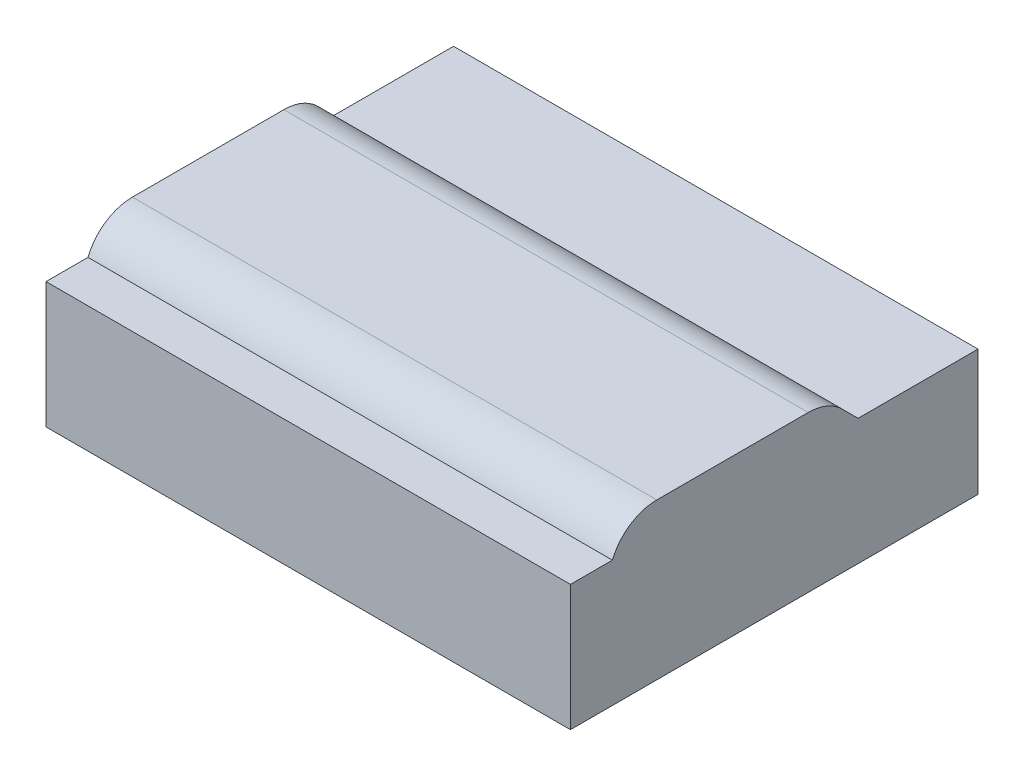
from build123d import *

# Parameters (mm, degrees)
SKETCH1_W           = 875
SKETCH1_H           = 680
BOSS_EXTRUDE1_DEPTH = 210
BOSS_EXTRUDE2_DEPTH = 875
FILLET1_R           = 80


with BuildPart() as part:
    # Sketch1 → Boss-Extrude1 (new body)
    with BuildSketch(Plane(origin=(0, 0, 0), x_dir=(1, 0, 0), z_dir=(0, 1, 0))):
        with Locations((0, 340)):
            Rectangle(SKETCH1_W, SKETCH1_H)
    extrude(amount=-BOSS_EXTRUDE1_DEPTH)

    # Sketch3 → Boss-Extrude2 (add)
    with BuildSketch(Plane.ZY.offset(437.5)):
        Polygon((-70, 0), (-70, 50), (-430, 50), (-480, 0), align=None)
    extrude(amount=-BOSS_EXTRUDE2_DEPTH)

    # Fillet1
    # the kernel refuses this fillet: 80 mm, written as the material it takes off along each edge
    with BuildSketch(Plane(origin=(-622.904962177, 50, -70), x_dir=(0, -1, 0), z_dir=(1, 0, 0))) as fillet1_piece_1:
        with BuildLine():
            CenterArc((80, 74.161984871), FILLET1_R, 180, 67.975687163)
            Line((0, 74.161984871), (-1.6, 74.161984871))
            Line((-1.6, 74.161984871), (-1.6, 0))
            Line((-1.6, 0), (0, -1.6))
            ThreePointArc((0, -1.6), (25, -1.6), (49.4, -1.483239697))
            Line((49.4, -1.483239697), (50, 0))
        make_face()
    extrude(amount=1245.809924355, mode=Mode.SUBTRACT)
    with BuildSketch(Plane(origin=(-520.342712475, 50, -430), x_dir=(0, -0.7071067811865477, -0.7071067811865474), z_dir=(1, 0, 0))) as fillet1_piece_2:
        with BuildLine():
            CenterArc((FILLET1_R * 0.414213562373, -FILLET1_R), FILLET1_R, 90, 45)
            Line((-FILLET1_R * 0.292893218813, -FILLET1_R * 0.292893218813), (-FILLET1_R * 0.307035354437, -FILLET1_R * 0.27875108319))
            Line((-FILLET1_R * 0.307035354437, -FILLET1_R * 0.27875108319), (-FILLET1_R * 0.00828427124746, FILLET1_R * 0.02))
            Line((-FILLET1_R * 0.00828427124746, FILLET1_R * 0.02), (FILLET1_R * 0.414213562373, FILLET1_R * 0.02))
            Line((FILLET1_R * 0.414213562373, FILLET1_R * 0.02), (FILLET1_R * 0.414213562373, 0))
        make_face()
    extrude(amount=1040.685424949, mode=Mode.SUBTRACT)


solid = part.part
